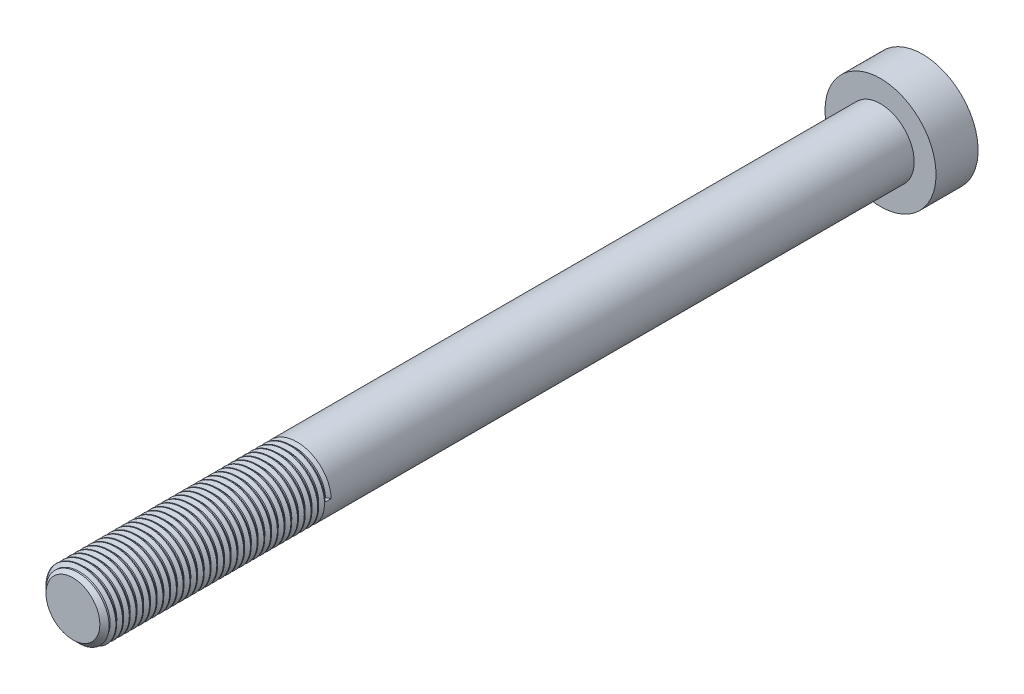
from build123d import *

# Parameters (mm, degrees)
SKETCH_1_R      = 10
EXTRUDE_1_DEPTH = 240
SKETCH_2_R      = 16.5
EXTRUDE_2_DEPTH = 12.5
CHAMFER_1_SIZE  = 2
THREAD_1_PITCH  = 2


with BuildPart() as part:
    # Sketch 1 → Бобышка-Вытянуть1 (new body)
    with BuildSketch(Plane.XY):
        Circle(SKETCH_1_R)
    extrude(amount=EXTRUDE_1_DEPTH)

    # Эскиз2 → Бобышка-Вытянуть2 (add)
    with BuildSketch(Plane(origin=(0, 0, 0), x_dir=(-1, 0, 0), z_dir=(0, 0, -1))):
        Circle(SKETCH_2_R)
    extrude(amount=EXTRUDE_2_DEPTH)

    # Фаска1
    chamfer_1_edges = [part.edges().sort_by_distance(p)[0] for p in [
        (-10, 0, 240),
    ]]
    chamfer(chamfer_1_edges, length=CHAMFER_1_SIZE)

    # Резьба1: the profile of Sketch 1 2 profile screwed along a right-hand helix of 32.5 turns, 10 arcs to a turn; built about Z, then put on its axis
    thread_1_z = Axis((0, 0, 0), (0, 0, 1))
    thread_1_corners = [(10.0003, 0, -0.000173205), (10.0003, 0, 1.7501732), (8.91746825, 0, 1.124999997), (8.91746825, 0, 0.624999997)]
    with BuildLine(mode=Mode.PRIVATE) as thread_1_profile:
        Line(thread_1_corners[0], thread_1_corners[1])
        Line(thread_1_corners[1], thread_1_corners[2])
        Line(thread_1_corners[2], thread_1_corners[3])
        Line(thread_1_corners[3], thread_1_corners[0])
    thread_1_cap = Face(thread_1_profile.wire())
    thread_1_turn_angles = [0, 18, 36, 54, 72, 90, 108, 126, 144, 162, 180, 198, 216, 234, 252, 270, 288, 306, 324, 342, 360]
    thread_1_turn_weights = [1, 0.9510565162951535, 1, 0.9510565162951535, 1, 0.9510565162951535, 1, 0.9510565162951535, 1, 0.9510565162951535, 1, 0.9510565162951535, 1, 0.9510565162951535, 1, 0.9510565162951535, 1, 0.9510565162951535, 1, 0.9510565162951535, 1]
    thread_1_turn_rails = [Edge.make_bspline([Vector(p[0], p[1], 0).rotate(thread_1_z, thread_1_turn_angles[k]) / thread_1_turn_weights[k] + Vector(0, 0, p[2] + THREAD_1_PITCH * thread_1_turn_angles[k] / 360) for k in range(21)], [0, 0, 0, 1, 1, 2, 2, 3, 3, 4, 4, 5, 5, 6, 6, 7, 7, 8, 8, 9, 9, 10, 10, 10], 2, thread_1_turn_weights) for p in thread_1_corners]
    thread_1_turn_sides = [Face.make_surface_from_curves(thread_1_turn_rails[p[0]], thread_1_turn_rails[p[1]]) for p in [(0, 1), (1, 2), (2, 3), (3, 0)]]
    thread_1_last_angles = [11520, 11538, 11556, 11574, 11592, 11610, 11628, 11646, 11664, 11682, 11700]
    thread_1_last_weights = [1, 0.9510565162951535, 1, 0.9510565162951535, 1, 0.9510565162951535, 1, 0.9510565162951535, 1, 0.9510565162951535, 1]
    thread_1_last_rails = [Edge.make_bspline([Vector(p[0], p[1], 0).rotate(thread_1_z, thread_1_last_angles[k]) / thread_1_last_weights[k] + Vector(0, 0, p[2] + THREAD_1_PITCH * thread_1_last_angles[k] / 360) for k in range(11)], [0, 0, 0, 1, 1, 2, 2, 3, 3, 4, 4, 5, 5, 5], 2, thread_1_last_weights) for p in thread_1_corners]
    thread_1_last_sides = [Face.make_surface_from_curves(thread_1_last_rails[p[0]], thread_1_last_rails[p[1]]) for p in [(0, 1), (1, 2), (2, 3), (3, 0)]]
    thread_1 = Plane(origin=(0, 0, 240), x_dir=(-1, 0, 0), z_dir=(0, 0, -1)) * Solid(Shell([*[p.moved(Location((0, 0, THREAD_1_PITCH * i))) for i in range(32) for p in thread_1_turn_sides], *thread_1_last_sides, thread_1_cap, thread_1_cap.rotate(thread_1_z, 11700).moved(Location((0, 0, THREAD_1_PITCH * 11700 / 360)))]))
    add(thread_1, mode=Mode.SUBTRACT)


solid = part.part
